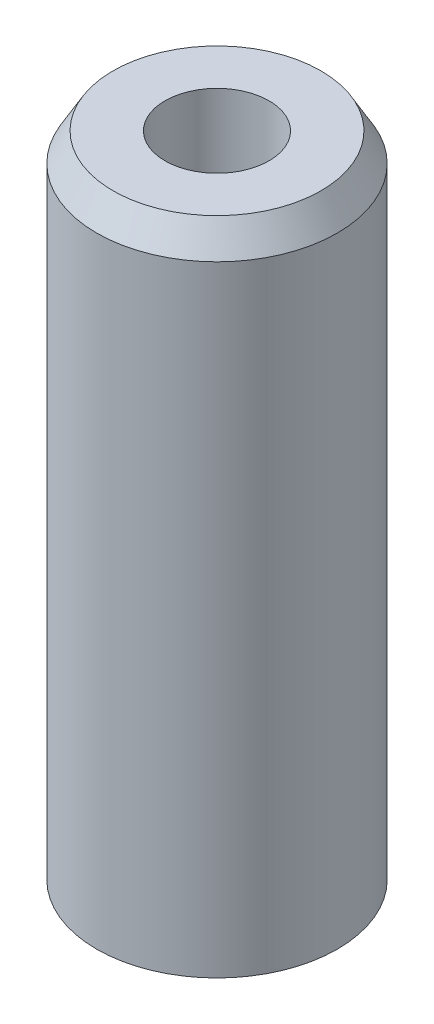
from build123d import *
from OCP.BRepFilletAPI import BRepFilletAPI_MakeChamfer

# Parameters (mm, degrees)
SKETCH1_R           = 10
BOSS_EXTRUDE1_DEPTH = 55.261616927
SKETCH2_R           = 4.323999584
CUT_EXTRUDE1_DEPTH  = 58.04249561
CHAMFER1_SIZE       = 2.359707423
CHAMFER1_SIZE2      = 1.362377716


with BuildPart() as part:
    # Sketch1 → Boss-Extrude1 (new body)
    with BuildSketch(Plane(origin=(0, 0, 0), x_dir=(1, 0, 0), z_dir=(0, 1, 0))):
        Circle(SKETCH1_R)
    extrude(amount=BOSS_EXTRUDE1_DEPTH)

    # Sketch2 → Cut-Extrude1 (cut, through all)
    with BuildSketch(Plane(origin=(0, 0, 0), x_dir=(1, 0, 0), z_dir=(0, 1, 0))):
        Circle(SKETCH2_R)
    extrude(amount=CUT_EXTRUDE1_DEPTH, mode=Mode.SUBTRACT)

    # Chamfer1: one chamfer whose edges measure the first distance from different faces: ONE call of the kernel's chamfer builder (chamfer() names one face for all edges)
    chamfer1_edges_1 = [part.edges().sort_by_distance(p)[0] for p in [
        (-10, 55.261616927, 0),
    ]]
    chamfer1_side_1 = [part.faces().sort_by_distance(p)[0] for p in [
        (-10, 27.630808464, 0),
    ]]
    chamfer1_edges_2 = [part.edges().sort_by_distance(p)[0] for p in [
        (-10, 0, 0),
    ]]
    chamfer1_side_2 = [part.faces().sort_by_distance(p)[0] for p in [
        (-9.717157288, 0, 0),
    ]]
    chamfer1 = BRepFilletAPI_MakeChamfer(part.part.solid().wrapped)
    for e in chamfer1_edges_1:
        chamfer1.Add(CHAMFER1_SIZE, CHAMFER1_SIZE2, e.wrapped, chamfer1_side_1[0].wrapped)  # the first distance lies on this face
    for e in chamfer1_edges_2:
        chamfer1.Add(CHAMFER1_SIZE, CHAMFER1_SIZE2, e.wrapped, chamfer1_side_2[0].wrapped)  # the first distance lies on this face
    add(Compound.cast(chamfer1.Shape()), mode=Mode.REPLACE)


solid = part.part
